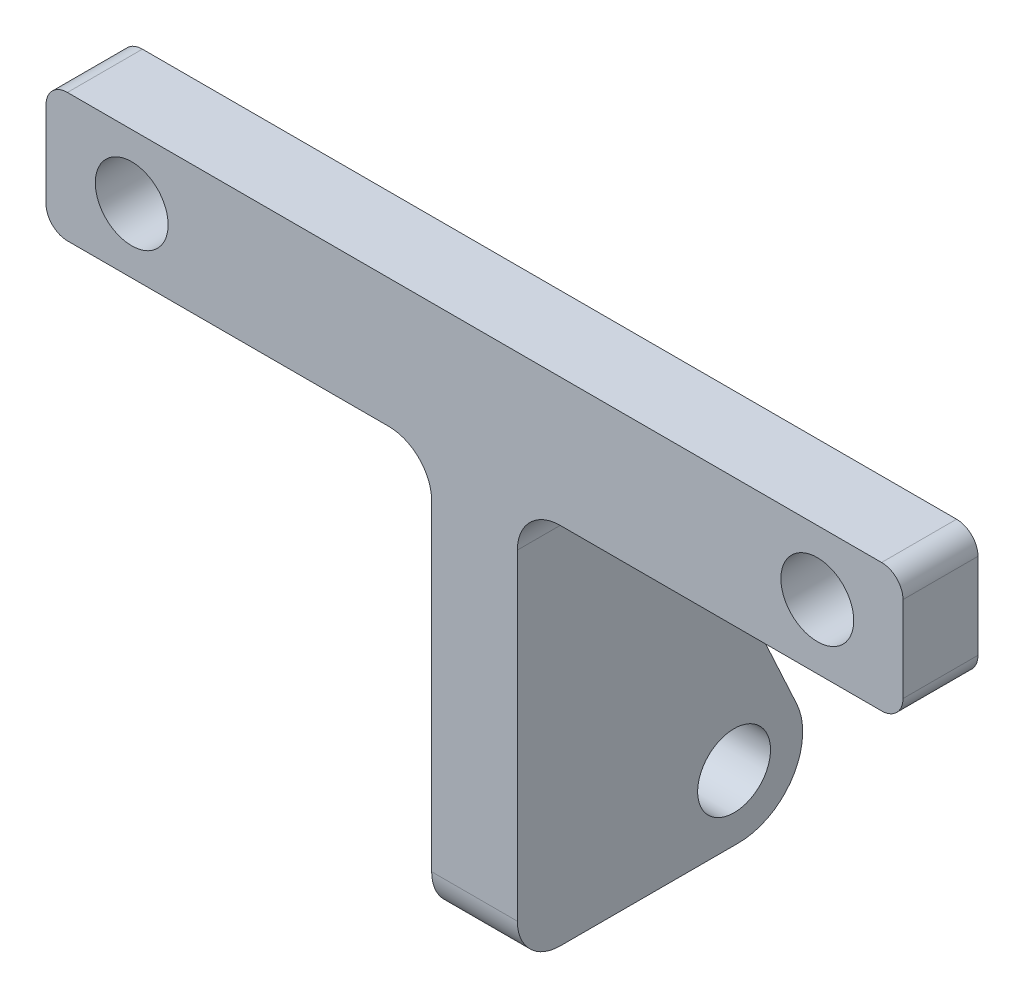
from build123d import *

# Parameters (mm, degrees)
SKETCH3_R           = 1.7
BOSS_EXTRUDE1_DEPTH = 3.5
BOSS_EXTRUDE2_DEPTH = 2
FILLET1_R           = 2
SKETCH5_R           = 1.7
CUT_EXTRUDE1_DEPTH  = 4
FILLET2_R           = 3


with BuildPart() as part:
    # Sketch3 → Boss-Extrude1 (new body)
    with BuildSketch(Plane.XY):
        with BuildLine():
            Line((-19, -3), (19, -3))
            ThreePointArc((19, -3), (19.707106781, -2.707106781), (20, -2))
            Line((20, -2), (20, 2))
            ThreePointArc((20, 2), (19.707106781, 2.707106781), (19, 3))
            Line((19, 3), (-19, 3))
            ThreePointArc((-19, 3), (-19.707106781, 2.707106781), (-20, 2))
            Line((-20, 2), (-20, -2))
            ThreePointArc((-20, -2), (-19.707106781, -2.707106781), (-19, -3))
        make_face()
        with Locations((-16, 0)):
            Circle(SKETCH3_R, mode=Mode.SUBTRACT)
        with Locations(Location((16, 0, 0), (0, 0, 180))):
            Circle(SKETCH3_R, mode=Mode.SUBTRACT)
    extrude(amount=BOSS_EXTRUDE1_DEPTH)

    # Sketch4 → Boss-Extrude2 (add, symmetric)
    with BuildSketch(Plane(origin=(0, 0, 0), x_dir=(0, 0, -1), z_dir=(1, 0, 0))):
        Polygon((0, 3), (11.5, -22), (-3.5, -22), (-3.5, 3), align=None)
    extrude(amount=BOSS_EXTRUDE2_DEPTH, both=True)

    # Fillet1
    # the kernel refuses this fillet: 2 mm, written as the material it adds along each edge
    with BuildSketch(Plane(origin=(2, -3, 0), x_dir=(1, 0, 0), z_dir=(0, 0, 1))) as fillet1_piece_1:
        with BuildLine():
            CenterArc((FILLET1_R, -FILLET1_R), FILLET1_R, 90, 90)
            Line((0, -FILLET1_R), (0, 0))
            Line((0, 0), (FILLET1_R, 0))
        make_face()
    extrude(amount=3.5)
    with BuildSketch(Plane(origin=(-2, 3, 0), x_dir=(0, 0, -1), z_dir=(0, -1, 0))) as fillet1_piece_2_section:
        with BuildLine():
            CenterArc((FILLET1_R, -FILLET1_R), FILLET1_R, 90, 90)
            Line((0, -FILLET1_R), (0, 0))
            Line((0, 0), (FILLET1_R, 0))
        make_face()
    fillet1_piece_2 = extrude(amount=6, mode=Mode.PRIVATE)
    fillet1_piece_2 = split(fillet1_piece_2, bisect_by=Plane(origin=(-2.500058987, 0.046625327, -1.35855235), z_dir=(3.171977462044394e-15, -0.4179056082321443, 0.9084904526785746)), keep=Keep.TOP, mode=Mode.PRIVATE)
    add(fillet1_piece_2)
    with BuildSketch(Plane(origin=(2, 3, 0), x_dir=(0, 0, -1), z_dir=(0, -1, 0))) as fillet1_piece_3_section:
        with BuildLine():
            CenterArc((FILLET1_R, FILLET1_R), FILLET1_R, 180, 90)
            Line((0, FILLET1_R), (0, 0))
            Line((0, 0), (FILLET1_R, 0))
        make_face()
    fillet1_piece_3 = extrude(amount=6, mode=Mode.PRIVATE)
    fillet1_piece_3 = split(fillet1_piece_3, bisect_by=Plane(origin=(2.500058987, 0.046625327, -1.35855235), z_dir=(3.171977462044394e-15, -0.4179056082321443, 0.9084904526785746)), keep=Keep.TOP, mode=Mode.PRIVATE)
    add(fillet1_piece_3)
    with BuildSketch(Plane(origin=(-2, -3, 0), x_dir=(-1, 0, 0), z_dir=(0, 0, 1))) as fillet1_piece_4:
        with BuildLine():
            CenterArc((FILLET1_R, FILLET1_R), FILLET1_R, 180, 90)
            Line((0, FILLET1_R), (0, 0))
            Line((0, 0), (FILLET1_R, 0))
        make_face()
    extrude(amount=3.5)
    with BuildSketch(Plane(origin=(2, -3, -5), x_dir=(1, 0, 0), z_dir=(0, 0, 1))) as fillet1_piece_5a_section:
        with BuildLine():
            CenterArc((FILLET1_R, -FILLET1_R), FILLET1_R, 90, 90)
            Line((0, -FILLET1_R), (0, 0))
            Line((0, 0), (FILLET1_R, 0))
        make_face()
    fillet1_piece_5a = extrude(amount=8.5, mode=Mode.PRIVATE)
    fillet1_piece_5a = split(fillet1_piece_5a, bisect_by=Plane(origin=(2.435770174, -3.481600485, 0), z_dir=(0, 0, -1)), keep=Keep.TOP, mode=Mode.PRIVATE)
    fillet1_piece_5a = split(fillet1_piece_5a, bisect_by=Plane(origin=(2.435770174, -2.915610611, -2.721180881), z_dir=(3.171977462044394e-15, -0.4179056082321443, 0.9084904526785746)), keep=Keep.TOP, mode=Mode.PRIVATE)
    with BuildSketch(Plane(origin=(2, 3, 0), x_dir=(0, 0, -1), z_dir=(0, -1, 0))) as fillet1_piece_5b_section:
        with BuildLine():
            CenterArc((FILLET1_R, FILLET1_R), FILLET1_R, 180, 90)
            Line((0, FILLET1_R), (0, 0))
            Line((0, 0), (FILLET1_R, 0))
        make_face()
    fillet1_piece_5b = extrude(amount=11, mode=Mode.PRIVATE)
    fillet1_piece_5b = split(fillet1_piece_5b, bisect_by=Plane(origin=(2.452790229, -3, -0.452790229), z_dir=(0, -1, 0)), keep=Keep.TOP, mode=Mode.PRIVATE)
    fillet1_piece_5 = fillet1_piece_5a & fillet1_piece_5b
    add(fillet1_piece_5)
    with BuildSketch(Plane(origin=(-2, -3, -5), x_dir=(-1, 0, 0), z_dir=(0, 0, 1))) as fillet1_piece_6a_section:
        with BuildLine():
            CenterArc((FILLET1_R, FILLET1_R), FILLET1_R, 180, 90)
            Line((0, FILLET1_R), (0, 0))
            Line((0, 0), (FILLET1_R, 0))
        make_face()
    fillet1_piece_6a = extrude(amount=8.5, mode=Mode.PRIVATE)
    fillet1_piece_6a = split(fillet1_piece_6a, bisect_by=Plane(origin=(-2.435770174, -3.481600485, 0), z_dir=(0, 0, -1)), keep=Keep.TOP, mode=Mode.PRIVATE)
    fillet1_piece_6a = split(fillet1_piece_6a, bisect_by=Plane(origin=(-2.435770174, -2.915610611, -2.721180881), z_dir=(3.171977462044394e-15, -0.4179056082321443, 0.9084904526785746)), keep=Keep.TOP, mode=Mode.PRIVATE)
    with BuildSketch(Plane(origin=(-2, 3, 0), x_dir=(0, 0, -1), z_dir=(0, -1, 0))) as fillet1_piece_6b_section:
        with BuildLine():
            CenterArc((FILLET1_R, -FILLET1_R), FILLET1_R, 90, 90)
            Line((0, -FILLET1_R), (0, 0))
            Line((0, 0), (FILLET1_R, 0))
        make_face()
    fillet1_piece_6b = extrude(amount=11, mode=Mode.PRIVATE)
    fillet1_piece_6b = split(fillet1_piece_6b, bisect_by=Plane(origin=(-2.452790229, -3, -0.452790229), z_dir=(0, -1, 0)), keep=Keep.TOP, mode=Mode.PRIVATE)
    fillet1_piece_6 = fillet1_piece_6a & fillet1_piece_6b
    add(fillet1_piece_6)
    # the kernel refuses this fillet: 2 mm, written as the material it takes off along each edge
    with BuildSketch(Plane(origin=(7, -22, 3.5), x_dir=(0, 0, -1), z_dir=(-1, 0, 0))) as fillet1_2_piece_1:
        with BuildLine():
            CenterArc((FILLET1_R, -FILLET1_R), FILLET1_R, 90, 90)
            Line((0, -FILLET1_R), (0, 0))
            Line((0, 0), (FILLET1_R, 0))
        make_face()
    extrude(amount=14, mode=Mode.SUBTRACT)

    # Sketch5 → Cut-Extrude1 (cut)
    with BuildSketch(Plane(origin=(2, 0, 0), x_dir=(0, 0, -1), z_dir=(1, 0, 0))):
        with Locations((6.615815201, -18.97305612)):
            Circle(SKETCH5_R)
    extrude(amount=-CUT_EXTRUDE1_DEPTH, mode=Mode.SUBTRACT)

    # Fillet2
    fillet2_edges = [part.edges().sort_by_distance(p)[0] for p in [
        (0, -22, -11.5),
    ]]
    fillet(fillet2_edges, radius=FILLET2_R)


solid = part.part
